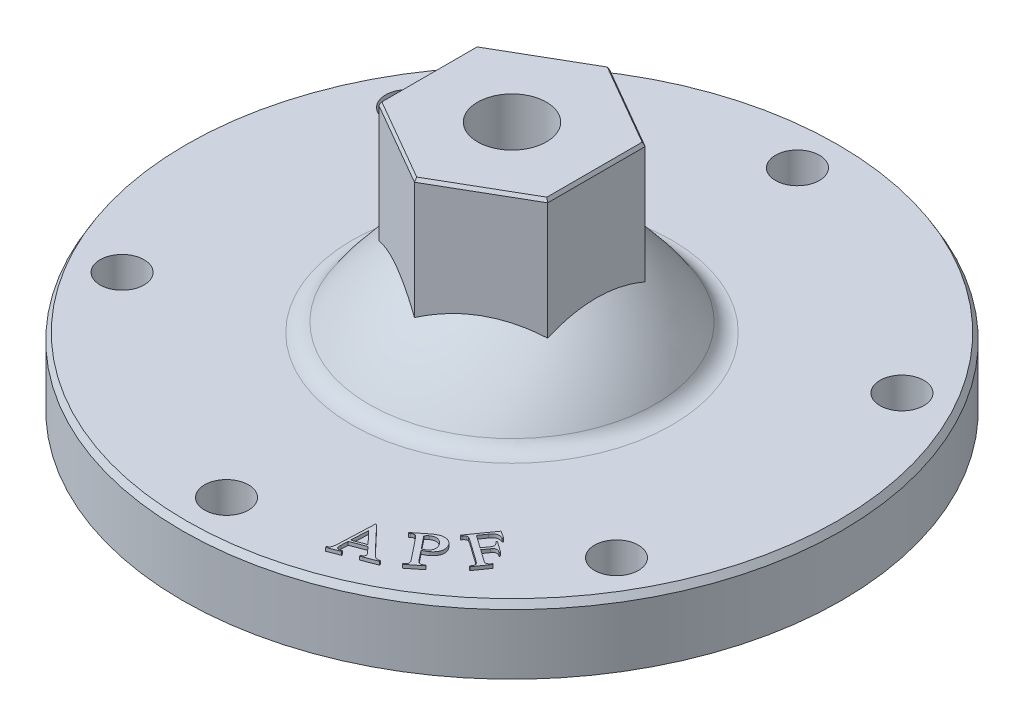
from build123d import *
from OCP.BRepFilletAPI import BRepFilletAPI_MakeChamfer

# Parameters (mm, degrees)
SKETCH1_R               = 48.8
BOSS_EXTRUDE1_DEPTH     = 10.5
BOSS_EXTRUDE2_DEPTH     = 27
FILLET1_R               = 3
M12X1_75_TAPPED_HOLE1_D = 10.2
CUT_EXTRUDE1_REACH      = 76.107
SKETCH8_R               = 3.25
CIRPATTERN1_COUNT       = 6
BOSS_EXTRUDE3_DEPTH     = 0.5
SKETCH10_R              = 34.9
BOSS_EXTRUDE4_DEPTH     = 2.5
SKETCH11_R              = 32.7
SKETCH11_R_2            = 31.45
CUT_EXTRUDE2_DEPTH      = 0.5
CHAMFER1_SIZE           = 0.78
CHAMFER1_SIZE_2         = 0.45033321
SKETCH12_R              = 29.95
SKETCH12_R_2            = 28.9
CUT_EXTRUDE3_DEPTH      = 0.5
CHAMFER2_SIZE           = 0.65
CHAMFER2_SIZE_2         = 0.375277675
SKETCH13_R              = 27.45
SKETCH13_R_2            = 26.4
CUT_EXTRUDE4_DEPTH      = 0.5
CHAMFER3_SIZE           = 0.66
CHAMFER3_SIZE_2         = 0.381051178
SKETCH14_R              = 24.4
SKETCH14_R_2            = 23.4
CUT_EXTRUDE5_DEPTH      = 0.5
CHAMFER4_SIZE           = 0.63
CHAMFER4_SIZE_2         = 0.36373067
SKETCH15_R              = 19.9
CUT_EXTRUDE6_DEPTH      = 6.5
SKETCH17_R              = 19.9
SKETCH16_R              = 14
SKETCH18_R              = 14
CUT_EXTRUDE7_DEPTH      = 2.9
FILLET2_R               = 2
SKETCH20_R              = 14
SKETCH19_R              = 8.05
SKETCH21_R              = 8.05
CUT_EXTRUDE8_DEPTH      = 5.4
CHAMFER5_SIZE           = 1
CHAMFER5_SIZE2          = 0.577350269
CHAMFER6_SIZE           = 0.5
CHAMFER6_SIZE2          = 0.288675135
FILLET3_R               = 0.3


with BuildPart() as part:
    # Sketch1 → Boss-Extrude1 (new body)
    with BuildSketch(Plane(origin=(0, 0, 0), x_dir=(1, 0, 0), z_dir=(0, 1, 0))):
        with Locations(Location((0, 0, 0), (0, 0, 90))):
            Circle(SKETCH1_R)
    extrude(amount=BOSS_EXTRUDE1_DEPTH)

    # Sketch2 → Revolve2 (revolve)
    with BuildSketch(Plane.XY, mode=Mode.PRIVATE) as revolve2_sk:
        with BuildLine():
            Line((-12.25, 21.4), (0, 21.4))
            Line((0, 21.4), (0, 10.5))
            Line((0, 10.5), (-22, 10.5))
            ThreePointArc((-22, 10.5), (-17.683172912, 16.44928311), (-12.25, 21.4))
        make_face()
    revolve(revolve2_sk.sketch.rotate(Axis((0, 0, 0), (0, 1, 0)), 270), axis=Axis((0, 0, 0), (0, 1, 0)))

    # Sketch4 → Boss-Extrude2 (add)
    with BuildSketch(Plane(origin=(0, 10.5, 0), x_dir=(1, 0, 0), z_dir=(0, 1, 0))):
        Polygon((0, 14.43375673), (-12.5, 7.216878365), (-12.5, -7.216878365), (0, -14.43375673), (12.5, -7.216878365), (12.5, 7.216878365), align=None)
    extrude(amount=BOSS_EXTRUDE2_DEPTH)

    # Fillet1
    fillet1_edges = [part.edges().sort_by_distance(p)[0] for p in [
        (0, 10.5, 22),
    ]]
    fillet(fillet1_edges, radius=FILLET1_R)

    # M12x1.75 Tapped Hole1 (through all)
    with Locations(Plane(origin=(0, 37.5, 0), x_dir=(1, 0, 0), z_dir=(0, 1, 0))):
        with Locations((0, 0)):
            Hole(M12X1_75_TAPPED_HOLE1_D / 2)

    # Sketch8 → Cut-Extrude1 (cut, up to next)
    with BuildSketch(Plane(origin=(0, 10.5, 0), x_dir=(1, 0, 0), z_dir=(0, 1, 0)), mode=Mode.PRIVATE) as cut_extrude1_sk1:
        with Locations(Location((0, 42.25, 0), (0, 0, 270))):
            Circle(SKETCH8_R)
    cut_extrude1_tool1 = extrude(cut_extrude1_sk1.sketch, amount=-CUT_EXTRUDE1_REACH, mode=Mode.PRIVATE) & part.part
    cut_extrude1 = cut_extrude1_tool1.solids().sort_by_distance((0, 10.5, -42.25))[0]
    add(cut_extrude1, mode=Mode.SUBTRACT)

    # CirPattern1: Cut-Extrude1 ×6 about axis
    cirpattern1_axis = Axis((0, 0, 0), (0, 1, 0))
    for i in range(1, CIRPATTERN1_COUNT):
        add(cut_extrude1.rotate(cirpattern1_axis, i * 360 / CIRPATTERN1_COUNT), mode=Mode.SUBTRACT)

    # Sketch9 → Boss-Extrude3 (add)
    # profile 1 of 3: a face of its own
    with BuildSketch(Plane(origin=(0, 10.5, 0), x_dir=(1, 0, 0), z_dir=(0, 1, 0))):
        with BuildLine():
            Line((17.240984085, -38.574143022), (15.130019769, -39.375468644))
            Line((15.130019769, -39.375468644), (15.086704871, -40.375533211))
            add(Edge.make_bspline(
                [(15.086704871, -40.375533211), (15.085100021, -40.432878856), (15.082138811, -40.538690947), (15.088684661, -40.684090518), (15.10063912, -40.804089625), (15.121875635, -40.872580874), (15.131293737, -40.902955798)],
                knots=[0, 0, 0, 0, 1.293178534, 2.386125866, 3.284269097, 4, 4, 4, 4], degree=3))
            add(Edge.make_bspline(
                [(15.131293737, -40.902955798), (15.140552326, -40.922642907), (15.159067723, -40.962013341), (15.204697388, -41.011834999), (15.2632498, -41.051119604), (15.321486915, -41.076393293), (15.377229164, -41.087540913), (15.427578308, -41.092878393), (15.486041238, -41.090642782), (15.551938035, -41.084129111), (15.626099747, -41.072889449), (15.707650644, -41.053711768), (15.797838893, -41.033373038), (15.859686106, -41.014624293), (15.891852395, -41.004873206)],
                knots=[0, 0, 0, 0, 0.922007334, 1.84383741, 2.831728574, 3.909490684, 4.519357959, 5.246107687, 6.059844418, 7.004266139, 8.065372243, 9.2497604, 10.569620208, 12, 12, 12, 12], degree=3))
            Line((15.891852395, -41.004873206), (15.94790697, -41.153927416))
            Line((15.94790697, -41.153927416), (14.23187261, -41.806198828))
            Line((14.23187261, -41.806198828), (14.175818036, -41.657144618))
            add(Edge.make_bspline(
                [(14.175818036, -41.657144618), (14.224433931, -41.62743673), (14.31267206, -41.573516742), (14.424259908, -41.488491107), (14.509364123, -41.413556584), (14.543296714, -41.356862718), (14.558008316, -41.33228288)],
                knots=[0, 0, 0, 0, 1.346613055, 2.444110452, 3.325438264, 4, 4, 4, 4], degree=3))
            add(Edge.make_bspline(
                [(14.558008316, -41.33228288), (14.568589427, -41.307804618), (14.591218361, -41.255455012), (14.618967845, -41.168076112), (14.642318991, -41.067373221), (14.664046399, -40.954392065), (14.681825779, -40.828544467), (14.695149588, -40.689500705), (14.707013394, -40.537475336), (14.711242962, -40.431608354), (14.713432364, -40.376807179)],
                knots=[0, 0, 0, 0, 0.657162587, 1.405418511, 2.256091179, 3.204719963, 4.24114467, 5.388113275, 6.647978232, 8, 8, 8, 8], degree=3))
            Line((14.713432364, -40.376807179), (14.927458921, -35.158635882))
            Line((14.927458921, -35.158635882), (15.067595357, -35.106403211))
            Line((15.067595357, -35.106403211), (18.689485248, -38.921936177))
            add(Edge.make_bspline(
                [(18.689485248, -38.921936177), (18.724569389, -38.958189401), (18.792232028, -39.028106712), (18.891974423, -39.125963439), (18.987161449, -39.211721921), (19.07515578, -39.287164965), (19.15890149, -39.349356539), (19.234521141, -39.403034921), (19.30650094, -39.442116311), (19.393258372, -39.482779157), (19.507298921, -39.50982427), (19.651183417, -39.518562881), (19.806802785, -39.500818354), (19.911134546, -39.472103308), (19.966000785, -39.45700257)],
                knots=[0, 0, 0, 0, 1.222057409, 2.356837848, 3.383683583, 4.325387707, 5.162709255, 5.910232385, 6.568647109, 7.144138353, 8.226908896, 9.381242008, 10.622841207, 12, 12, 12, 12], degree=3))
            Line((19.966000785, -39.45700257), (20.02205536, -39.60605678))
            Line((20.02205536, -39.60605678), (17.87032408, -40.42394398))
            Line((17.87032408, -40.42394398), (17.814269506, -40.27488977))
            add(Edge.make_bspline(
                [(17.814269506, -40.27488977), (17.863118333, -40.252403696), (17.952473339, -40.21127183), (18.068722152, -40.143040921), (18.155863666, -40.074779936), (18.213492688, -40.003955056), (18.246692622, -39.933443289), (18.262784041, -39.864365776), (18.262269849, -39.794844286), (18.248159454, -39.751483102), (18.241048652, -39.729631637)],
                knots=[0, 0, 0, 0, 1.671940618, 3.05833887, 4.184765667, 5.09658226, 5.870645038, 6.588452158, 7.288663592, 8, 8, 8, 8], degree=3))
            add(Edge.make_bspline(
                [(18.241048652, -39.729631637), (18.225814783, -39.69642389), (18.191291668, -39.621168233), (18.109228546, -39.50696009), (18.001508506, -39.373617693), (17.915616174, -39.282294594), (17.869050113, -39.232784272)],
                knots=[0, 0, 0, 0, 0.701455629, 1.589644232, 2.693238717, 4, 4, 4, 4], degree=3))
            Line((17.869050113, -39.232784272), (17.240984085, -38.574143022))
        make_face()
        Polygon((17.01549182, -38.318075534), (15.253594627, -36.467000609), (15.141485478, -39.030223424), align=None, mode=Mode.SUBTRACT)
    # profile 2 of 3: a face of its own
    with BuildSketch(Plane(origin=(0, 10.5, 0), x_dir=(1, 0, 0), z_dir=(0, 1, 0))):
        with BuildLine():
            Line((21.675753314, -35.150246449), (22.730598488, -36.471350852))
            add(Edge.make_bspline(
                [(22.730598488, -36.471350852), (22.757931376, -36.505127423), (22.809870448, -36.569311046), (22.888086559, -36.65728531), (22.960018182, -36.734119185), (23.027527173, -36.797543022), (23.088644967, -36.850081908), (23.145742062, -36.887986275), (23.197529722, -36.915756418), (23.231904524, -36.924605642), (23.247829334, -36.928705221)],
                knots=[0, 0, 0, 0, 1.488294125, 2.828117457, 4.032077255, 5.092074569, 6.001052432, 6.787846972, 7.438445985, 8, 8, 8, 8], degree=3))
            add(Edge.make_bspline(
                [(23.247829334, -36.928705221), (23.289073302, -36.933512588), (23.372681381, -36.943257885), (23.501651073, -36.915106153), (23.630730995, -36.858259786), (23.709607485, -36.800043924), (23.751046537, -36.76945927)],
                knots=[0, 0, 0, 0, 0.909992665, 1.844699808, 2.867677859, 4, 4, 4, 4], degree=3))
            Line((23.751046537, -36.76945927), (23.924306131, -36.630596802))
            Line((23.924306131, -36.630596802), (24.022401636, -36.754171659))
            Line((24.022401636, -36.754171659), (22.079601044, -38.305864198))
            Line((22.079601044, -38.305864198), (21.981505538, -38.182289341))
            Line((21.981505538, -38.182289341), (22.152217197, -38.045974807))
            add(Edge.make_bspline(
                [(22.152217197, -38.045974807), (22.175098381, -38.02685617), (22.219194946, -37.990010777), (22.277244759, -37.929706223), (22.324695909, -37.867223559), (22.361849094, -37.802822666), (22.390862817, -37.737326355), (22.40859819, -37.669390881), (22.416498626, -37.599825985), (22.414424192, -37.553383102), (22.413380555, -37.530017929)],
                knots=[0, 0, 0, 0, 1.184066663, 2.281930457, 3.317892185, 4.293131665, 5.230263347, 6.155164401, 7.071872805, 8, 8, 8, 8], degree=3))
            add(Edge.make_bspline(
                [(22.413380555, -37.530017929), (22.410742237, -37.515498624), (22.404979443, -37.483784579), (22.38752443, -37.433218722), (22.360216203, -37.37584431), (22.322877784, -37.311857711), (22.278181189, -37.239532693), (22.222831313, -37.161139462), (22.159611883, -37.074537049), (22.112938382, -37.015597141), (22.088518817, -36.984759795)],
                knots=[0, 0, 0, 0, 0.552469252, 1.206740659, 1.997075495, 2.93080272, 3.981814617, 5.182654714, 6.525965631, 8, 8, 8, 8], degree=3))
            Line((22.088518817, -36.984759795), (19.748240333, -34.054634311))
            add(Edge.make_bspline(
                [(19.748240333, -34.054634311), (19.72082626, -34.020927735), (19.66853152, -33.956629496), (19.591522485, -33.867985603), (19.51972835, -33.791355051), (19.452087711, -33.728628225), (19.391959679, -33.674414454), (19.333944415, -33.637091078), (19.283250901, -33.607737981), (19.249085892, -33.59879618), (19.233557422, -33.594732007)],
                knots=[0, 0, 0, 0, 1.48969929, 2.841731594, 4.026241816, 5.087239921, 6.006466152, 6.79400354, 7.451857886, 8, 8, 8, 8], degree=3))
            add(Edge.make_bspline(
                [(19.233557422, -33.594732007), (19.192301641, -33.590951064), (19.108125287, -33.583236607), (18.978977303, -33.61157074), (18.850495643, -33.67122192), (18.771037679, -33.72870828), (18.729066251, -33.759073828)],
                knots=[0, 0, 0, 0, 0.906068134, 1.848698771, 2.863635839, 4, 4, 4, 4], degree=3))
            Line((18.729066251, -33.759073828), (18.558354593, -33.895388361))
            Line((18.558354593, -33.895388361), (18.457711152, -33.770539536))
            Line((18.457711152, -33.770539536), (20.120238872, -32.443065295))
            add(Edge.make_bspline(
                [(20.120238872, -32.443065295), (20.170255902, -32.404305444), (20.267533517, -32.328921801), (20.41102819, -32.220832186), (20.551457247, -32.125663294), (20.686468011, -32.040105368), (20.816031759, -31.964347809), (20.941928198, -31.900651865), (21.061782163, -31.845523271), (21.215153564, -31.787581125), (21.405990595, -31.736171018), (21.639148817, -31.706087953), (21.875510962, -31.710253857), (22.072108118, -31.741545364), (22.227681444, -31.781324811), (22.341056267, -31.821594871), (22.448300916, -31.873973021), (22.5524488, -31.931820535), (22.650881944, -32.001672625), (22.744935968, -32.080150061), (22.833422503, -32.168973068), (22.887742307, -32.233313984), (22.91532379, -32.265983799)],
                knots=[0, 0, 0, 0, 1.201037612, 2.335885928, 3.408946756, 4.419656719, 5.369395477, 6.256134206, 7.096611303, 7.872041827, 9.365740447, 10.836318625, 12.319542677, 13.836801577, 14.603130884, 15.365422936, 16.115299608, 16.866085353, 17.624104435, 18.402211172, 19.18870498, 20, 20, 20, 20], degree=3))
            add(Edge.make_bspline(
                [(22.91532379, -32.265983799), (22.950074432, -32.312145535), (23.018301325, -32.402776143), (23.105507147, -32.545589597), (23.174577327, -32.692386424), (23.228753132, -32.840961971), (23.264655914, -32.993206249), (23.283730447, -33.147412238), (23.286213089, -33.304577777), (23.272013161, -33.462924046), (23.242048302, -33.621786169), (23.191603597, -33.777558096), (23.123698478, -33.930024068), (23.03720625, -34.078553082), (22.933422017, -34.22460574), (22.810512169, -34.36686985), (22.670164497, -34.506454314), (22.56612387, -34.592629042), (22.512750028, -34.636837505)],
                knots=[0, 0, 0, 0, 1.020673314, 2.003916054, 2.950509038, 3.883349334, 4.793425429, 5.70837669, 6.624004713, 7.565647144, 8.513429166, 9.474574392, 10.452130778, 11.457377412, 12.50680388, 13.613759837, 14.77583586, 16, 16, 16, 16], degree=3))
            add(Edge.make_bspline(
                [(22.512750028, -34.636837505), (22.454647153, -34.680853989), (22.333436248, -34.772678667), (22.134403824, -34.90148509), (21.913519801, -35.029085482), (21.7568281, -35.108932386), (21.675753314, -35.150246449)],
                knots=[0, 0, 0, 0, 0.889073541, 1.854734538, 2.890005423, 4, 4, 4, 4], degree=3))
        make_face()
        with BuildLine():
            add(Edge.make_bspline(
                [(21.522877202, -34.959151309), (21.586849781, -34.925242999), (21.706494606, -34.861825925), (21.870397741, -34.765609248), (22.008441926, -34.678296279), (22.088025023, -34.617381955), (22.12418991, -34.589700704)],
                knots=[0, 0, 0, 0, 1.229233247, 2.298975563, 3.227004743, 4, 4, 4, 4], degree=3))
            add(Edge.make_bspline(
                [(22.12418991, -34.589700704), (22.151798721, -34.565970056), (22.206302324, -34.519122481), (22.280037454, -34.441017467), (22.341902678, -34.355008523), (22.39594854, -34.264544887), (22.440097448, -34.167717517), (22.472301753, -34.064359118), (22.497204256, -33.955393099), (22.51043006, -33.841414708), (22.515125824, -33.724970398), (22.505633334, -33.608435849), (22.485230539, -33.493238418), (22.453331789, -33.379692079), (22.409376616, -33.267468772), (22.353232323, -33.157173776), (22.285114869, -33.047528838), (22.231823911, -32.978115991), (22.204449869, -32.942460595)],
                knots=[0, 0, 0, 0, 0.949670702, 1.87478103, 2.794566937, 3.708661666, 4.621143049, 5.563805973, 6.528930959, 7.533638043, 8.553627642, 9.564973362, 10.577896182, 11.60227027, 12.637316763, 13.717638714, 14.827616247, 16, 16, 16, 16], degree=3))
            add(Edge.make_bspline(
                [(22.204449869, -32.942460595), (22.164755532, -32.895171695), (22.086364365, -32.801782251), (21.951086428, -32.680291727), (21.804875131, -32.576811916), (21.650750154, -32.490228298), (21.490997318, -32.424653461), (21.328782402, -32.384461445), (21.166200673, -32.369466341), (21.004744088, -32.383455338), (20.846170377, -32.419202046), (20.691479261, -32.477490104), (20.541918116, -32.557703617), (20.449820625, -32.626157469), (20.40305968, -32.660913755)],
                knots=[0, 0, 0, 0, 1.082493174, 2.137783612, 3.180019283, 4.220948475, 5.23399769, 6.201043774, 7.143658211, 8.085653739, 9.033058347, 9.988199383, 10.978542234, 12, 12, 12, 12], degree=3))
            add(Edge.make_bspline(
                [(20.40305968, -32.660913755), (20.373325552, -32.6859238), (20.309789729, -32.739365213), (20.217512929, -32.835267631), (20.117913216, -32.94734809), (20.051898237, -33.030029793), (20.017047497, -33.073679258)],
                knots=[0, 0, 0, 0, 0.822878901, 1.758325932, 2.816571603, 4, 4, 4, 4], degree=3))
            Line((20.017047497, -33.073679258), (21.522877202, -34.959151309))
        make_face(mode=Mode.SUBTRACT)
    # profile 3 of 3: a face of its own
    with BuildSketch(Plane(origin=(0, 10.5, 0), x_dir=(1, 0, 0), z_dir=(0, 1, 0))):
        with BuildLine():
            Line((23.847143799, -29.116720358), (25.714780303, -30.434002858))
            Line((25.714780303, -30.434002858), (26.326284752, -29.567704889))
            add(Edge.make_bspline(
                [(26.326284752, -29.567704889), (26.357374867, -29.520527244), (26.415799404, -29.431871024), (26.477795688, -29.294798144), (26.507770722, -29.164163201), (26.507317315, -29.059336305), (26.490955414, -28.978310501), (26.464797653, -28.916735505), (26.43202938, -28.851511976), (26.388147337, -28.783557757), (26.332856532, -28.714248088), (26.268574416, -28.641214911), (26.19531777, -28.564765681), (26.140620228, -28.515482731), (26.112258195, -28.489928298)],
                knots=[0, 0, 0, 0, 1.619327646, 3.04304015, 4.290401409, 5.435600969, 6.020984785, 6.649878641, 7.347254591, 8.114351691, 8.964846187, 9.888533332, 10.905152108, 12, 12, 12, 12], degree=3))
            Line((26.112258195, -28.489928298), (26.203983862, -28.359983603))
            Line((26.203983862, -28.359983603), (27.811730976, -29.493814768))
            Line((27.811730976, -29.493814768), (27.720005308, -29.623759463))
            add(Edge.make_bspline(
                [(27.720005308, -29.623759463), (27.675798575, -29.59469783), (27.593635655, -29.540683691), (27.473454676, -29.474126326), (27.365069205, -29.429225838), (27.266286546, -29.406146412), (27.176388375, -29.401631798), (27.091406361, -29.407564792), (27.009998919, -29.426558979), (26.93105626, -29.459396344), (26.853333142, -29.50899407), (26.774176802, -29.577293099), (26.694715104, -29.667682189), (26.643819814, -29.736311019), (26.616749365, -29.772813673)],
                knots=[0, 0, 0, 0, 1.469129697, 2.730533989, 3.810341053, 4.717407086, 5.532629036, 6.301569489, 7.076906253, 7.84358178, 8.665009044, 9.627079782, 10.737879016, 12, 12, 12, 12], degree=3))
            Line((26.616749365, -29.772813673), (26.005244917, -30.639111642))
            Line((26.005244917, -30.639111642), (27.498334946, -31.692682848))
            add(Edge.make_bspline(
                [(27.498334946, -31.692682848), (27.553653382, -31.730964541), (27.654142735, -31.800505598), (27.794103433, -31.887958946), (27.907672148, -31.949336176), (27.977495367, -31.973188583), (28.006648019, -31.983147462)],
                knots=[0, 0, 0, 0, 1.373518009, 2.495080188, 3.37166455, 4, 4, 4, 4], degree=3))
            add(Edge.make_bspline(
                [(28.006648019, -31.983147462), (28.026133113, -31.986596872), (28.066268192, -31.99370191), (28.129478521, -31.986926373), (28.195586571, -31.970236338), (28.238753353, -31.951142258), (28.261441539, -31.941106531)],
                knots=[0, 0, 0, 0, 0.89861959, 1.850961888, 2.870479267, 4, 4, 4, 4], degree=3))
            add(Edge.make_bspline(
                [(28.261441539, -31.941106531), (28.29249362, -31.924459214), (28.353828344, -31.891577082), (28.43681191, -31.829332903), (28.511995186, -31.759700403), (28.553064987, -31.705647766), (28.573563601, -31.678669205)],
                knots=[0, 0, 0, 0, 1.025316356, 2.025226441, 3.014357999, 4, 4, 4, 4], degree=3))
            Line((28.573563601, -31.678669205), (28.693316556, -31.507957546))
            Line((28.693316556, -31.507957546), (28.823261251, -31.599683213))
            Line((28.823261251, -31.599683213), (27.384951829, -33.638031376))
            Line((27.384951829, -33.638031376), (27.255007134, -33.546305709))
            Line((27.255007134, -33.546305709), (27.373486121, -33.378141985))
            add(Edge.make_bspline(
                [(27.373486121, -33.378141985), (27.404501391, -33.330821609), (27.462566047, -33.242231653), (27.513415706, -33.099225875), (27.533415192, -32.960237837), (27.513289046, -32.873044926), (27.503430816, -32.830335917)],
                knots=[0, 0, 0, 0, 1.160304696, 2.172242697, 3.104724207, 4, 4, 4, 4], degree=3))
            add(Edge.make_bspline(
                [(27.503430816, -32.830335917), (27.497514319, -32.815669894), (27.484576358, -32.783598818), (27.452575423, -32.736186705), (27.40836168, -32.686029121), (27.354615206, -32.629210663), (27.288732565, -32.568686845), (27.21000711, -32.505229332), (27.120888554, -32.436301766), (27.056825572, -32.389790582), (27.02314503, -32.365337742)],
                knots=[0, 0, 0, 0, 0.56025326, 1.225139516, 2.016596215, 2.933636501, 4.000526669, 5.189624683, 6.522470239, 8, 8, 8, 8], degree=3))
            Line((27.02314503, -32.365337742), (23.954157078, -30.199592819))
            add(Edge.make_bspline(
                [(23.954157078, -30.199592819), (23.8988539, -30.161281345), (23.798392267, -30.091686189), (23.658585468, -30.004757467), (23.545801064, -29.942688847), (23.476289869, -29.919049131), (23.447117972, -29.909128206)],
                knots=[0, 0, 0, 0, 1.376171781, 2.499900928, 3.370450544, 4, 4, 4, 4], degree=3))
            add(Edge.make_bspline(
                [(23.447117972, -29.909128206), (23.427629217, -29.90573516), (23.387935838, -29.898824432), (23.325446883, -29.904422473), (23.259660748, -29.917513141), (23.217096934, -29.9362762), (23.194872387, -29.946073267)],
                knots=[0, 0, 0, 0, 0.911097789, 1.855662411, 2.880341608, 4, 4, 4, 4], degree=3))
            add(Edge.make_bspline(
                [(23.194872387, -29.946073267), (23.164233239, -29.962275412), (23.103214406, -29.994542497), (23.020819951, -30.05662579), (22.944812712, -30.12675946), (22.90359948, -30.18189322), (22.882750325, -30.20978456)],
                knots=[0, 0, 0, 0, 1.005888844, 2.003259497, 2.989878998, 4, 4, 4, 4], degree=3))
            Line((22.882750325, -30.20978456), (22.764271338, -30.377948284))
            Line((22.764271338, -30.377948284), (22.634326643, -30.286222616))
            Line((22.634326643, -30.286222616), (25.128755207, -26.750962522))
            Line((25.128755207, -26.750962522), (26.203983862, -27.442726929))
            Line((26.203983862, -27.442726929), (26.117354065, -27.565027819))
            add(Edge.make_bspline(
                [(26.117354065, -27.565027819), (26.054794467, -27.543279851), (25.937148492, -27.502381876), (25.767625138, -27.458950968), (25.617245643, -27.432372122), (25.483433363, -27.428219524), (25.362194607, -27.44120756), (25.249527185, -27.46937964), (25.142639416, -27.512156601), (25.037714108, -27.569809819), (24.932892207, -27.652645246), (24.824403626, -27.764281295), (24.705028124, -27.903540207), (24.628475743, -28.010656315), (24.587318976, -28.068245022)],
                knots=[0, 0, 0, 0, 1.326368778, 2.494292684, 3.50274331, 4.379416727, 5.166743113, 5.938469978, 6.698382312, 7.467713744, 8.32880913, 9.363546005, 10.582566345, 12, 12, 12, 12], degree=3))
            Line((24.587318976, -28.068245022), (23.847143799, -29.116720358))
        make_face()
    extrude(amount=BOSS_EXTRUDE3_DEPTH)

    # Sketch10 → Boss-Extrude4 (add)
    with BuildSketch(Plane.XZ):
        with Locations(Location((0, 0, 0), (0, 0, 90))):
            Circle(SKETCH10_R)
    extrude(amount=BOSS_EXTRUDE4_DEPTH)

    # Sketch11 → Cut-Extrude2 (cut)
    with BuildSketch(Plane.XZ.offset(2.5)):
        with Locations(Location((0, 0, 0), (0, 0, 270))):
            Circle(SKETCH11_R)
        with Locations(Location((0, 0, 0), (0, 0, 270))):
            Circle(SKETCH11_R_2, mode=Mode.SUBTRACT)
    extrude(amount=-CUT_EXTRUDE2_DEPTH, mode=Mode.SUBTRACT)

    # Chamfer1
    # the kernel refuses this chamfer: 0.78, 0.45033321 mm, written as the material it adds along each edge
    with BuildSketch(Plane(origin=(0, -2, 0), x_dir=(0, 0, -1), z_dir=(-1, 0, 0))) as chamfer1_piece_1:
        Polygon((31.45 + CHAMFER1_SIZE, 0), (31.45, CHAMFER1_SIZE_2), (31.45, 0), align=None)
    revolve(axis=Axis((0, -2, 0), (0, -1, 0)))
    with BuildSketch(Plane(origin=(0, -2, 0), x_dir=(0, 0, -1), z_dir=(-1, 0, 0))) as chamfer1_piece_2_section:
        Polygon((32.7, CHAMFER1_SIZE), (32.7 - CHAMFER1_SIZE_2, 0), (32.7, 0), align=None)
    chamfer1_piece_2 = revolve(axis=Axis((0, -2, 0), (0, -1, 0)), mode=Mode.PRIVATE)
    chamfer1_piece_2 = split(chamfer1_piece_2, bisect_by=Plane(origin=(0, -2.5, 32.414446866), z_dir=(0, 1, 0)), keep=Keep.TOP, mode=Mode.PRIVATE)
    add(chamfer1_piece_2)

    # Sketch12 → Cut-Extrude3 (cut)
    with BuildSketch(Plane.XZ.offset(2.5)):
        with Locations(Location((0, 0, 0), (0, 0, 270))):
            Circle(SKETCH12_R)
        with Locations(Location((0, 0, 0), (0, 0, 270))):
            Circle(SKETCH12_R_2, mode=Mode.SUBTRACT)
    extrude(amount=-CUT_EXTRUDE3_DEPTH, mode=Mode.SUBTRACT)

    # Chamfer2
    # the kernel refuses this chamfer: 0.65, 0.375277675 mm, written as the material it adds along each edge
    with BuildSketch(Plane(origin=(0, -2, 0), x_dir=(0, 0, -1), z_dir=(-1, 0, 0))) as chamfer2_piece_1:
        Polygon((28.9 + CHAMFER2_SIZE, 0), (28.9, CHAMFER2_SIZE_2), (28.9, 0), align=None)
    revolve(axis=Axis((0, -2, 0), (0, -1, 0)))
    with BuildSketch(Plane(origin=(0, -2, 0), x_dir=(0, 0, -1), z_dir=(-1, 0, 0))) as chamfer2_piece_2_section:
        Polygon((29.95, CHAMFER2_SIZE), (29.95 - CHAMFER2_SIZE_2, 0), (29.95, 0), align=None)
    chamfer2_piece_2 = revolve(axis=Axis((0, -2, 0), (0, -1, 0)), mode=Mode.PRIVATE)
    chamfer2_piece_2 = split(chamfer2_piece_2, bisect_by=Plane(origin=(0, -2.5, 29.737560096), z_dir=(0, 1, 0)), keep=Keep.TOP, mode=Mode.PRIVATE)
    add(chamfer2_piece_2)

    # Sketch13 → Cut-Extrude4 (cut)
    with BuildSketch(Plane.XZ.offset(2.5)):
        with Locations(Location((0, 0, 0), (0, 0, 270))):
            Circle(SKETCH13_R)
        with Locations(Location((0, 0, 0), (0, 0, 270))):
            Circle(SKETCH13_R_2, mode=Mode.SUBTRACT)
    extrude(amount=-CUT_EXTRUDE4_DEPTH, mode=Mode.SUBTRACT)

    # Chamfer3
    # the kernel refuses this chamfer: 0.66, 0.381051178 mm, written as the material it adds along each edge
    with BuildSketch(Plane(origin=(0, -2, 0), x_dir=(0, 0, -1), z_dir=(-1, 0, 0))) as chamfer3_piece_1_section:
        Polygon((27.45, CHAMFER3_SIZE), (27.45 - CHAMFER3_SIZE_2, 0), (27.45, 0), align=None)
    chamfer3_piece_1 = revolve(axis=Axis((0, -2, 0), (0, -1, 0)), mode=Mode.PRIVATE)
    chamfer3_piece_1 = split(chamfer3_piece_1, bisect_by=Plane(origin=(0, -2.5, 27.231163714), z_dir=(0, 1, 0)), keep=Keep.TOP, mode=Mode.PRIVATE)
    add(chamfer3_piece_1)
    with BuildSketch(Plane(origin=(0, -2, 0), x_dir=(0, 0, -1), z_dir=(-1, 0, 0))) as chamfer3_piece_2:
        Polygon((26.4 + CHAMFER3_SIZE, 0), (26.4, CHAMFER3_SIZE_2), (26.4, 0), align=None)
    revolve(axis=Axis((0, -2, 0), (0, -1, 0)))

    # Sketch14 → Cut-Extrude5 (cut)
    with BuildSketch(Plane.XZ.offset(2.5)):
        with Locations(Location((0, 0, 0), (0, 0, 270))):
            Circle(SKETCH14_R)
        with Locations(Location((0, 0, 0), (0, 0, 270))):
            Circle(SKETCH14_R_2, mode=Mode.SUBTRACT)
    extrude(amount=-CUT_EXTRUDE5_DEPTH, mode=Mode.SUBTRACT)

    # Chamfer4
    # the kernel refuses this chamfer: 0.63, 0.36373067 mm, written as the material it adds along each edge
    with BuildSketch(Plane(origin=(0, -2, 0), x_dir=(0, 0, -1), z_dir=(-1, 0, 0))) as chamfer4_piece_1_section:
        Polygon((24.4, CHAMFER4_SIZE), (24.4 - CHAMFER4_SIZE_2 * 0.999999998871, 0), (24.4, 0), align=None)
    chamfer4_piece_1 = revolve(axis=Axis((0, -2, 0), (0, -1, 0)), mode=Mode.PRIVATE)
    chamfer4_piece_1 = split(chamfer4_piece_1, bisect_by=Plane(origin=(0, -2.5, 24.197262764), z_dir=(0, 1, 0)), keep=Keep.TOP, mode=Mode.PRIVATE)
    add(chamfer4_piece_1)
    with BuildSketch(Plane(origin=(0, -2, 0), x_dir=(0, 0, -1), z_dir=(-1, 0, 0))) as chamfer4_piece_2:
        Polygon((23.4 + CHAMFER4_SIZE, 0), (23.4, CHAMFER4_SIZE_2 * 0.999999998871), (23.4, 0), align=None)
    revolve(axis=Axis((0, -2, 0), (0, -1, 0)))

    # Sketch15 → Cut-Extrude6 (cut)
    with BuildSketch(Plane.XZ.offset(2.5)):
        with Locations(Location((0, 0, 0), (0, 0, 270))):
            Circle(SKETCH15_R)
    extrude(amount=-CUT_EXTRUDE6_DEPTH, mode=Mode.SUBTRACT)

    # Sketch17 → Cut-Loft1 section 0
    with BuildSketch(Plane.XZ.offset(-4)):
        Circle(SKETCH17_R)
    # Sketch16 → Cut-Loft1 section 1
    with BuildSketch(Plane(origin=(0, 7.3, 0), x_dir=(-1, 0, 0), z_dir=(0, -1, 0))):
        Circle(SKETCH16_R)
    loft(mode=Mode.SUBTRACT)

    # Sketch18 → Cut-Extrude7 (cut)
    with BuildSketch(Plane.XZ.offset(-7.3)):
        with Locations(Location((0, 0, 0), (0, 0, 270))):
            Circle(SKETCH18_R)
    extrude(amount=-CUT_EXTRUDE7_DEPTH, mode=Mode.SUBTRACT)

    # Fillet2
    fillet2_edges = [part.edges().sort_by_distance(p)[0] for p in [
        (0, -2.5, 19.9),
    ]]
    fillet(fillet2_edges, radius=FILLET2_R)

    # Sketch20 → Cut-Loft2 section 0
    with BuildSketch(Plane.XZ.offset(-10.2)):
        Circle(SKETCH20_R)
    # Sketch19 → Cut-Loft2 section 1
    with BuildSketch(Plane(origin=(0, 16, 0), x_dir=(-1, 0, 0), z_dir=(0, -1, 0))):
        Circle(SKETCH19_R)
    loft(mode=Mode.SUBTRACT)

    # Sketch21 → Cut-Extrude8 (cut)
    with BuildSketch(Plane.XZ.offset(-16)):
        with Locations(Location((0, 0, 0), (0, 0, 270))):
            Circle(SKETCH21_R)
    extrude(amount=-CUT_EXTRUDE8_DEPTH, mode=Mode.SUBTRACT)

    # Chamfer5: one chamfer whose edges measure the first distance from different faces: ONE call of the kernel's chamfer builder (chamfer() names one face for all edges)
    chamfer5_edges_1 = [part.edges().sort_by_distance(p)[0] for p in [
        (0, 0, 48.8),
    ]]
    chamfer5_side_1 = [part.faces().sort_by_distance(p)[0] for p in [
        (0, 0, 47.419727563),
    ]]
    chamfer5_edges_2 = [part.edges().sort_by_distance(p)[0] for p in [
        (0, 10.5, 48.8),
    ]]
    chamfer5_side_2 = [part.faces().sort_by_distance(p)[0] for p in [
        (0, 5.25, 48.8),
    ]]
    chamfer5 = BRepFilletAPI_MakeChamfer(part.part.solid().wrapped)
    for e in chamfer5_edges_1:
        chamfer5.Add(CHAMFER5_SIZE, CHAMFER5_SIZE2, e.wrapped, chamfer5_side_1[0].wrapped)  # the first distance lies on this face
    for e in chamfer5_edges_2:
        chamfer5.Add(CHAMFER5_SIZE, CHAMFER5_SIZE2, e.wrapped, chamfer5_side_2[0].wrapped)  # the first distance lies on this face
    add(Compound.cast(chamfer5.Shape()), mode=Mode.REPLACE)

    # Chamfer6: one chamfer whose edges measure the first distance from different faces: ONE call of the kernel's chamfer builder (chamfer() names one face for all edges)
    chamfer6_edges_1 = [part.edges().sort_by_distance(p)[0] for p in [
        (6.25, 37.5, -10.825317547),
    ]]
    chamfer6_side_1 = [part.faces().sort_by_distance(p)[0] for p in [
        (6.25, 29.089421722, -10.825317547),
    ]]
    chamfer6_edges_2 = [part.edges().sort_by_distance(p)[0] for p in [
        (-6.25, 37.5, -10.825317547),
    ]]
    chamfer6_side_2 = [part.faces().sort_by_distance(p)[0] for p in [
        (-6.25, 29.089421727, -10.825317547),
    ]]
    chamfer6_edges_3 = [part.edges().sort_by_distance(p)[0] for p in [
        (-12.5, 37.5, 0),
    ]]
    chamfer6_side_3 = [part.faces().sort_by_distance(p)[0] for p in [
        (-12.5, 29.089421722, 0),
    ]]
    chamfer6_edges_4 = [part.edges().sort_by_distance(p)[0] for p in [
        (-6.25, 37.5, 10.825317547),
    ]]
    chamfer6_side_4 = [part.faces().sort_by_distance(p)[0] for p in [
        (-6.25, 29.089421722, 10.825317547),
    ]]
    chamfer6_edges_5 = [part.edges().sort_by_distance(p)[0] for p in [
        (6.25, 37.5, 10.825317547),
    ]]
    chamfer6_side_5 = [part.faces().sort_by_distance(p)[0] for p in [
        (6.25, 29.089421722, 10.825317548),
    ]]
    chamfer6_edges_6 = [part.edges().sort_by_distance(p)[0] for p in [
        (12.5, 37.5, 0),
    ]]
    chamfer6_side_6 = [part.faces().sort_by_distance(p)[0] for p in [
        (12.5, 29.089421722, 0),
    ]]
    chamfer6 = BRepFilletAPI_MakeChamfer(part.part.solid().wrapped)
    for e in chamfer6_edges_1:
        chamfer6.Add(CHAMFER6_SIZE, CHAMFER6_SIZE2, e.wrapped, chamfer6_side_1[0].wrapped)  # the first distance lies on this face
    for e in chamfer6_edges_2:
        chamfer6.Add(CHAMFER6_SIZE, CHAMFER6_SIZE2, e.wrapped, chamfer6_side_2[0].wrapped)  # the first distance lies on this face
    for e in chamfer6_edges_3:
        chamfer6.Add(CHAMFER6_SIZE, CHAMFER6_SIZE2, e.wrapped, chamfer6_side_3[0].wrapped)  # the first distance lies on this face
    for e in chamfer6_edges_4:
        chamfer6.Add(CHAMFER6_SIZE, CHAMFER6_SIZE2, e.wrapped, chamfer6_side_4[0].wrapped)  # the first distance lies on this face
    for e in chamfer6_edges_5:
        chamfer6.Add(CHAMFER6_SIZE, CHAMFER6_SIZE2, e.wrapped, chamfer6_side_5[0].wrapped)  # the first distance lies on this face
    for e in chamfer6_edges_6:
        chamfer6.Add(CHAMFER6_SIZE, CHAMFER6_SIZE2, e.wrapped, chamfer6_side_6[0].wrapped)  # the first distance lies on this face
    add(Compound.cast(chamfer6.Shape()), mode=Mode.REPLACE)

    # Fillet3
    fillet3_edges = [part.edges().sort_by_distance(p)[0] for p in [
        (5.692209589, 16, -5.692209589),
        (-5.692209589, 16, 5.692209589),
        (9.899494937, 7.3, -9.899494937),
        (-9.899494937, 7.3, 9.899494937),
    ]]
    fillet(fillet3_edges, radius=FILLET3_R)


solid = part.part
